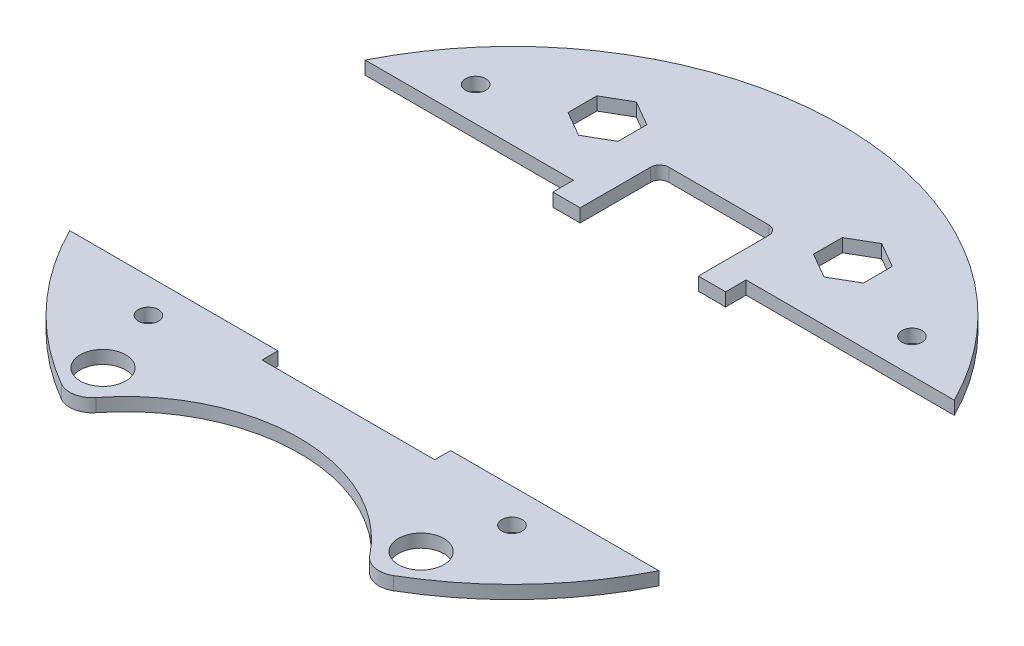
from build123d import *

# Parameters (mm, degrees)
BOSS_EXTRUDE1_DEPTH  = 2.9
SOLENOID_PLACEMENT_W = 38
SOLENOID_PLACEMENT_H = 64
CUT_EXTRUDE1_DEPTH   = 103.571487266
CUT_EXTRUDE5_DEPTH   = 103.571487266
SKETCH6_R            = 2.225
CUT_EXTRUDE6_DEPTH   = 103.571487266
CUT_EXTRUDE3_DEPTH   = 103.571487266
CUT_EXTRUDE7_DEPTH   = 98.286484159
SKETCH8_R            = 5
CUT_EXTRUDE8_DEPTH   = 98.286484159


with BuildPart() as part:
    # Sketch1 → Boss-Extrude1 (new body)
    with BuildSketch(Plane(origin=(0, 0, 0), x_dir=(1, 0, 0), z_dir=(0, 1, 0))):
        with BuildLine():
            ThreePointArc((36.543377003, -62.616544118), (0, 72.5), (-36.543377003, -62.616544118))
            ThreePointArc((-36.543377003, -62.616544118), (-33.085954668, -63.20954405), (-30.089832649, -61.38507948))
            ThreePointArc((-30.089832649, -61.38507948), (0, -46.75), (30.089832649, -61.38507948))
            ThreePointArc((30.089832649, -61.38507948), (33.085954668, -63.20954405), (36.543377003, -62.616544118))
        make_face()
    extrude(amount=BOSS_EXTRUDE1_DEPTH)

    # solenoid placement → Cut-Extrude1 (cut, through all)
    with BuildSketch(Plane(origin=(0, 2.9, 0), x_dir=(1, 0, 0), z_dir=(0, 1, 0))):
        with Locations((0, -4)):
            Rectangle(SOLENOID_PLACEMENT_W, SOLENOID_PLACEMENT_H)
    extrude(amount=-CUT_EXTRUDE1_DEPTH, mode=Mode.SUBTRACT)

    # Sketch5 → Cut-Extrude5 (cut, through all)
    with BuildSketch(Plane(origin=(0, 2.9, 0), x_dir=(1, 0, 0), z_dir=(0, 1, 0))):
        Polygon((-21.5, 51.175426481), (-27, 54.350852961), (-32.5, 51.175426481), (-32.5, 44.824573519), (-27, 41.649147039), (-21.5, 44.824573519), align=None)
        Polygon((21.5, 51.175426481), (21.5, 44.824573519), (27, 41.649147039), (32.5, 44.824573519), (32.5, 51.175426481), (27, 54.350852961), align=None)
    extrude(amount=-CUT_EXTRUDE5_DEPTH, mode=Mode.SUBTRACT)

    # Sketch6 → Cut-Extrude6 (cut, through all)
    with BuildSketch(Plane(origin=(0, 2.9, 0), x_dir=(1, 0, 0), z_dir=(0, 1, 0))):
        with Locations((48, 40)):
            Circle(SKETCH6_R)
        with Locations((-48, 40)):
            Circle(SKETCH6_R)
        with Locations((40, -40)):
            Circle(SKETCH6_R)
        with Locations((-40, -40)):
            Circle(SKETCH6_R)
    extrude(amount=-CUT_EXTRUDE6_DEPTH, mode=Mode.SUBTRACT)

    # Sketch3 → Cut-Extrude3 (cut, through all)
    with BuildSketch(Plane(origin=(0, 2.9, 0), x_dir=(1, 0, 0), z_dir=(0, 1, 0))):
        Polygon((-19, 28), (-19, 32.5), (-72.5, 32.5), (-72.5, -32.5), (72.5, -32.5), (72.5, 32.5), (19, 32.5), (19, 28), align=None)
    extrude(amount=-CUT_EXTRUDE3_DEPTH, mode=Mode.SUBTRACT)


with BuildPart() as cut_extrude3_piece_1:
    # of the separate pieces the step leaves, piece 1, a body of its own (cut_extrude3_pieces)
    add(part.part.solids().sort_by_distance((64.807406984, 0, -32.5))[0])

    # Sketch7 → Cut-Extrude7 (cut, through all)
    with BuildSketch(Plane(origin=(0, 2.9, 0), x_dir=(1, 0, 0), z_dir=(0, 1, 0))):
        with BuildLine():
            Line((13, 28), (13, 43.5))
            ThreePointArc((13, 43.5), (12.414213562, 44.914213562), (11, 45.5))
            Line((11, 45.5), (-11, 45.5))
            ThreePointArc((-11, 45.5), (-12.414213562, 44.914213562), (-13, 43.5))
            Line((-13, 43.5), (-13, 28))
            Line((-13, 28), (13, 28))
        make_face()
    extrude(amount=-CUT_EXTRUDE7_DEPTH, mode=Mode.SUBTRACT)


with BuildPart() as cut_extrude3_piece_2:
    # of the separate pieces the step leaves, piece 2, a body of its own (cut_extrude3_pieces)
    add(part.part.solids().sort_by_distance((-36.543377003, 0, 62.616544118))[0])

    # Sketch8 → Cut-Extrude8 (cut, through all)
    with BuildSketch(Plane(origin=(0, 2.9, 0), x_dir=(1, 0, 0), z_dir=(0, 1, 0))):
        with Locations((35, -55)):
            Circle(SKETCH8_R)
        with Locations((-35, -55)):
            Circle(SKETCH8_R)
    extrude(amount=-CUT_EXTRUDE8_DEPTH, mode=Mode.SUBTRACT)


solid = Compound([cut_extrude3_piece_1.part, cut_extrude3_piece_2.part])
